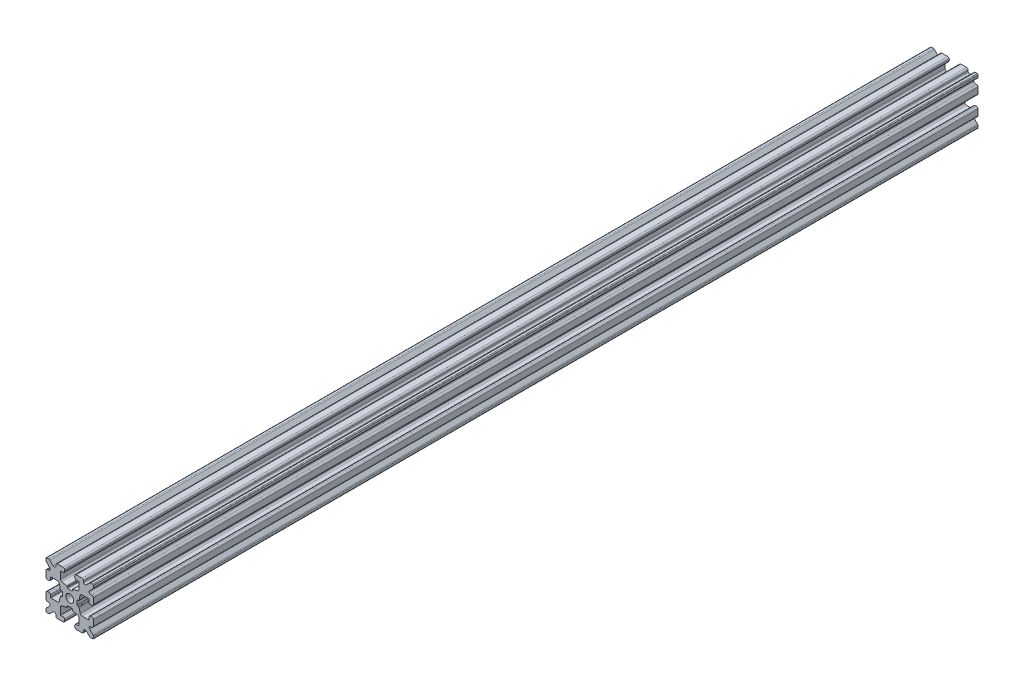
from build123d import *

# Parameters (mm, degrees)
SKETCH1_W           = 15
SKETCH1_H           = 15
SKETCH1_R           = 1.25
BOSS_EXTRUDE1_DEPTH = 140
FILLET1_R           = 0.25
CUT_EXTRUDE1_DEPTH  = 281.200820841
CUT_EXTRUDE3_DEPTH  = 281.200820841
FILLET3_R           = 0.5
FILLET4_R           = 0.5
FILLET5_R           = 3
FILLET6_R           = 0.2
CUT_EXTRUDE4_DEPTH  = 281.200820841
FILLET8_R           = 0.5
SKETCH6_W           = 5.1529354
SKETCH6_H           = 1.651
SKETCH6_W_2         = 1.651
SKETCH6_H_2         = 5.1529354
CUT_EXTRUDE5_DEPTH  = 281.200820841
FILLET10_R          = 0.2


with BuildPart() as part:
    # Sketch1 → Boss-Extrude1 (new, symmetric)
    with BuildSketch(Plane.XY):
        Rectangle(SKETCH1_W, SKETCH1_H)
        Circle(SKETCH1_R, mode=Mode.SUBTRACT)
    extrude(amount=BOSS_EXTRUDE1_DEPTH, both=True)

    # Fillet1
    fillet1_edges = [part.edges().sort_by_distance(p)[0] for p in [
        (7.5, -7.5, 0),
        (-7.5, -7.5, 0),
        (7.5, 7.5, 0),
        (-7.5, 7.5, 0),
    ]]
    fillet(fillet1_edges, radius=FILLET1_R)

    # Sketch2 → Cut-Extrude1 (cut, through all)
    with BuildSketch(Plane.XY.offset(140)):
        Polygon((-7.5, 1.6), (-6.1, 1.6), (-6.1, 2.9), (-3.4, 2.9), (-3.4, -2.9), (-6.1, -2.9), (-6.1, -1.6), (-7.5, -1.6), align=None)
        Polygon((2.9, 6.1), (1.6, 6.1), (1.6, 7.5), (-1.6, 7.5), (-1.6, 6.1), (-2.9, 6.1), (-2.9, 3.4), (2.9, 3.4), align=None)
        Polygon((-1.6, -7.5), (-1.6, -6.1), (-2.9, -6.1), (-2.9, -3.4), (2.9, -3.4), (2.9, -6.1), (1.6, -6.1), (1.6, -7.5), align=None)
        Polygon((6.1, -2.9), (6.1, -1.6), (7.5, -1.6), (7.5, 1.6), (6.1, 1.6), (6.1, 2.9), (3.4, 2.9), (3.4, -2.9), align=None)
    extrude(amount=-CUT_EXTRUDE1_DEPTH, mode=Mode.SUBTRACT)

    # Sketch4 → Cut-Extrude3 (cut, through all)
    with BuildSketch(Plane.XY.offset(140)):
        Polygon((-3.4, 2.9), (-2.75, 0), (-3.4, -2.9), align=None)
        Polygon((-2.9, 3.4), (0, 2.75), (2.9, 3.4), align=None)
        Polygon((3.4, 2.9), (2.75, 0), (3.4, -2.9), align=None)
        Polygon((-2.9, -3.4), (0, -2.75), (2.9, -3.4), align=None)
    extrude(amount=-CUT_EXTRUDE3_DEPTH, mode=Mode.SUBTRACT)

    # Fillet3
    fillet3_edges = [part.edges().sort_by_distance(p)[0] for p in [
        (-6.1, -1.6, 0),
        (-7.5, -1.6, 0),
        (-6.1, 1.6, 0),
        (-7.5, 1.6, 0),
        (-1.6, -7.5, 0),
        (-1.6, -6.1, 0),
        (1.6, -7.5, 0),
        (1.6, -6.1, 0),
        (6.1, -1.6, 0),
        (7.5, -1.6, 0),
        (7.5, 1.6, 0),
        (6.1, 1.6, 0),
        (1.6, 7.5, 0),
        (1.6, 6.1, 0),
        (-1.6, 7.5, 0),
        (-1.6, 6.1, 0),
    ]]
    fillet(fillet3_edges, radius=FILLET3_R)

    # Fillet4
    fillet4_edges = [part.edges().sort_by_distance(p)[0] for p in [
        (-3.4, 2.9, 0),
        (-3.4, -2.9, 0),
        (2.9, -3.4, 0),
        (-2.9, -3.4, 0),
        (3.4, -2.9, 0),
        (3.4, 2.9, 0),
        (-2.9, 3.4, 0),
        (2.9, 3.4, 0),
    ]]
    fillet(fillet4_edges, radius=FILLET4_R)

    # Fillet5
    fillet5_edges = [part.edges().sort_by_distance(p)[0] for p in [
        (0, -2.75, 0),
        (2.75, 0, 0),
        (-2.75, 0, 0),
        (0, 2.75, 0),
    ]]
    fillet(fillet5_edges, radius=FILLET5_R)

    # Fillet6
    fillet6_edges = [part.edges().sort_by_distance(p)[0] for p in [
        (-2.9, -6.1, 0),
        (2.9, -6.1, 0),
        (6.1, -2.9, 0),
        (6.1, 2.9, 0),
        (2.9, 6.1, 0),
        (-2.9, 6.1, 0),
        (-6.1, -2.9, 0),
        (-6.1, 2.9, 0),
    ]]
    fillet(fillet6_edges, radius=FILLET6_R)

    # Sketch5 → Cut-Extrude4 (cut, through all)
    with BuildSketch(Plane.XY.offset(140)):
        Polygon((-7.5, 6.439339828), (-5.460660172, 4.4), (-7.5, 4.4), align=None)
        Polygon((-6.439339828, 7.5), (-4.4, 5.460660172), (-4.4, 7.5), align=None)
        Polygon((4.4, 7.5), (6.439339828, 7.5), (4.4, 5.460660172), align=None)
        Polygon((7.5, 6.439339828), (7.5, 4.4), (5.460660172, 4.4), align=None)
        Polygon((7.5, -6.439339828), (5.460660172, -4.4), (7.5, -4.4), align=None)
        Polygon((6.439339828, -7.5), (4.4, -5.460660172), (4.4, -7.5), align=None)
        Polygon((-4.4, -7.5), (-6.439339828, -7.5), (-4.4, -5.460660172), align=None)
        Polygon((-7.5, -6.439339828), (-7.5, -4.4), (-5.460660172, -4.4), align=None)
    extrude(amount=-CUT_EXTRUDE4_DEPTH, mode=Mode.SUBTRACT)

    # Fillet8
    fillet8_edges = [part.edges().sort_by_distance(p)[0] for p in [
        (-5.460660172, 4.4, 0),
        (-7.5, 4.4, 0),
        (-5.460660172, -4.4, 0),
        (-7.5, -4.4, 0),
        (-4.4, -7.5, 0),
        (-4.4, -5.460660172, 0),
        (4.4, -7.5, 0),
        (4.4, -5.460660172, 0),
        (5.460660172, -4.4, 0),
        (7.5, -4.4, 0),
        (7.5, 4.4, 0),
        (5.460660172, 4.4, 0),
        (4.4, 5.460660172, 0),
        (4.4, 7.5, 0),
        (-4.4, 5.460660172, 0),
        (-4.4, 7.5, 0),
        (-6.439339828, 7.5, 0),
        (-7.5, 6.439339828, 0),
        (6.439339828, 7.5, 0),
        (7.5, 6.439339828, 0),
        (6.439339828, -7.5, 0),
        (7.5, -6.439339828, 0),
        (-6.439339828, -7.5, 0),
        (-7.5, -6.439339828, 0),
    ]]
    fillet(fillet8_edges, radius=FILLET8_R)

    # Sketch6 → Cut-Extrude5 (cut, through all)
    with BuildSketch(Plane.XY.offset(140)):
        with Locations((4.9235323, 0)):
            Rectangle(SKETCH6_W, SKETCH6_H)
        with Locations((0, -4.9235323)):
            Rectangle(SKETCH6_W_2, SKETCH6_H_2)
        with Locations((-4.9235323, 0)):
            Rectangle(SKETCH6_W, SKETCH6_H)
        with Locations((0, 4.9235323)):
            Rectangle(SKETCH6_W_2, SKETCH6_H_2)
    extrude(amount=-CUT_EXTRUDE5_DEPTH, mode=Mode.SUBTRACT)

    # Fillet10
    fillet10_edges = [part.edges().sort_by_distance(p)[0] for p in [
        (-2.935025862, 0.8255, 0),
        (-2.935025862, -0.8255, 0),
        (2.935025862, -0.8255, 0),
        (2.935025862, 0.8255, 0),
        (0.8255, 2.935025862, 0),
        (-0.8255, 2.935025862, 0),
        (-2.3470646, 0.8255, 0),
        (-2.3470646, -0.8255, 0),
        (0.8255, 2.3470646, 0),
        (-0.8255, 2.3470646, 0),
        (2.3470646, 0.8255, 0),
        (2.3470646, -0.8255, 0),
        (0.8255, -2.935025862, 0),
        (0.8255, -2.3470646, 0),
        (-0.8255, -2.3470646, 0),
        (-0.8255, -2.935025862, 0),
    ]]
    fillet(fillet10_edges, radius=FILLET10_R)


solid = part.part
